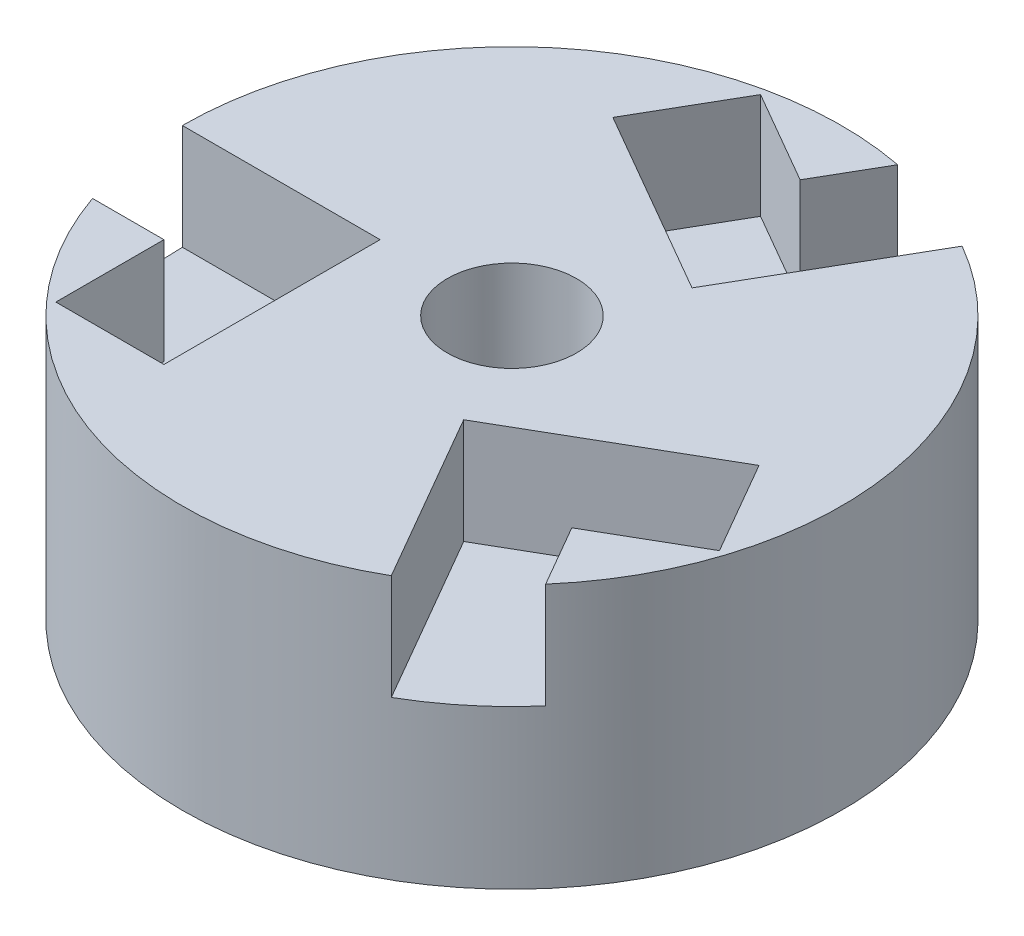
from build123d import *

# Parameters (mm, degrees)
SKETCH1_R           = 25
BOSS_EXTRUDE1_DEPTH = 20
CUT_EXTRUDE1_START  = -8
CUT_EXTRUDE1_DEPTH  = 8
CIRPATTERN1_COUNT   = 3
SKETCH7_R           = 15.1
CUT_EXTRUDE3_DEPTH  = 8.7
SKETCH8_R           = 4.9
CUT_EXTRUDE4_DEPTH  = 38.117246665


with BuildPart() as part:
    # Sketch1 → Boss-Extrude1 (new body)
    with BuildSketch(Plane(origin=(0, 0, 0), x_dir=(1, 0, 0), z_dir=(0, 1, 0))):
        Circle(SKETCH1_R)
    extrude(amount=BOSS_EXTRUDE1_DEPTH)

    # Sketch2 → Cut-Extrude1 (cut)
    with BuildSketch(Plane(origin=(0, 20, 0), x_dir=(1, 0, 0), z_dir=(0, 1, 0)).offset(CUT_EXTRUDE1_START)):
        with BuildLine():
            Line((-25, 0), (-10, 0))
            Line((-10, 0), (-10, -16.4))
            Line((-10, -16.4), (-18.2, -16.4))
            Line((-18.2, -16.4), (-18.2, -8.2))
            Line((-18.2, -8.2), (-23.616943071, -8.2))
            ThreePointArc((-23.616943071, -8.2), (-24.651811057, -4.157909525), (-25, 0))
        make_face()
    cut_extrude1 = extrude(amount=CUT_EXTRUDE1_DEPTH, mode=Mode.SUBTRACT)

    # CirPattern1: Cut-Extrude1 ×3 about axis
    cirpattern1_axis = Axis((0, 0, 0), (0, -1, 0))
    for i in range(1, CIRPATTERN1_COUNT):
        add(cut_extrude1.rotate(cirpattern1_axis, i * 360 / CIRPATTERN1_COUNT), mode=Mode.SUBTRACT)

    # Sketch7 → Cut-Extrude3 (cut)
    with BuildSketch(Plane.XZ):
        Circle(SKETCH7_R)
    extrude(amount=-CUT_EXTRUDE3_DEPTH, mode=Mode.SUBTRACT)

    # Sketch8 → Cut-Extrude4 (cut, through all)
    with BuildSketch(Plane.XZ.offset(-8.7)):
        Circle(SKETCH8_R)
    extrude(amount=-CUT_EXTRUDE4_DEPTH, mode=Mode.SUBTRACT)


solid = part.part
